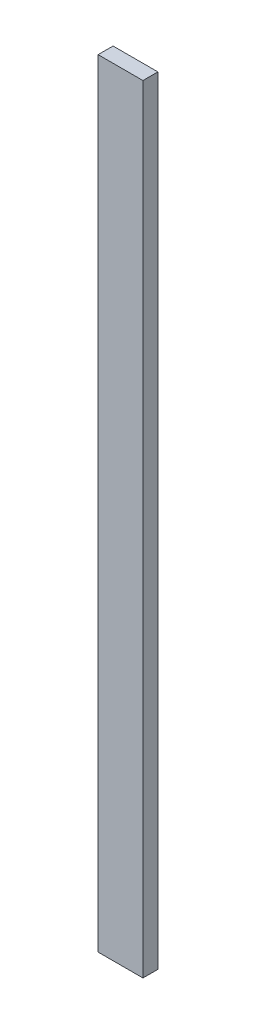
from build123d import *

# Parameters (mm, degrees)
SKETCH1_W           = 30
SKETCH1_H           = 519.999989053
BOSS_EXTRUDE1_DEPTH = 10


with BuildPart() as part:
    # Sketch1 → Boss-Extrude1 (new body)
    with BuildSketch(Plane.XY):
        with Locations((70, -271.477858709)):
            Rectangle(SKETCH1_W, SKETCH1_H)
    extrude(amount=BOSS_EXTRUDE1_DEPTH)


solid = part.part
